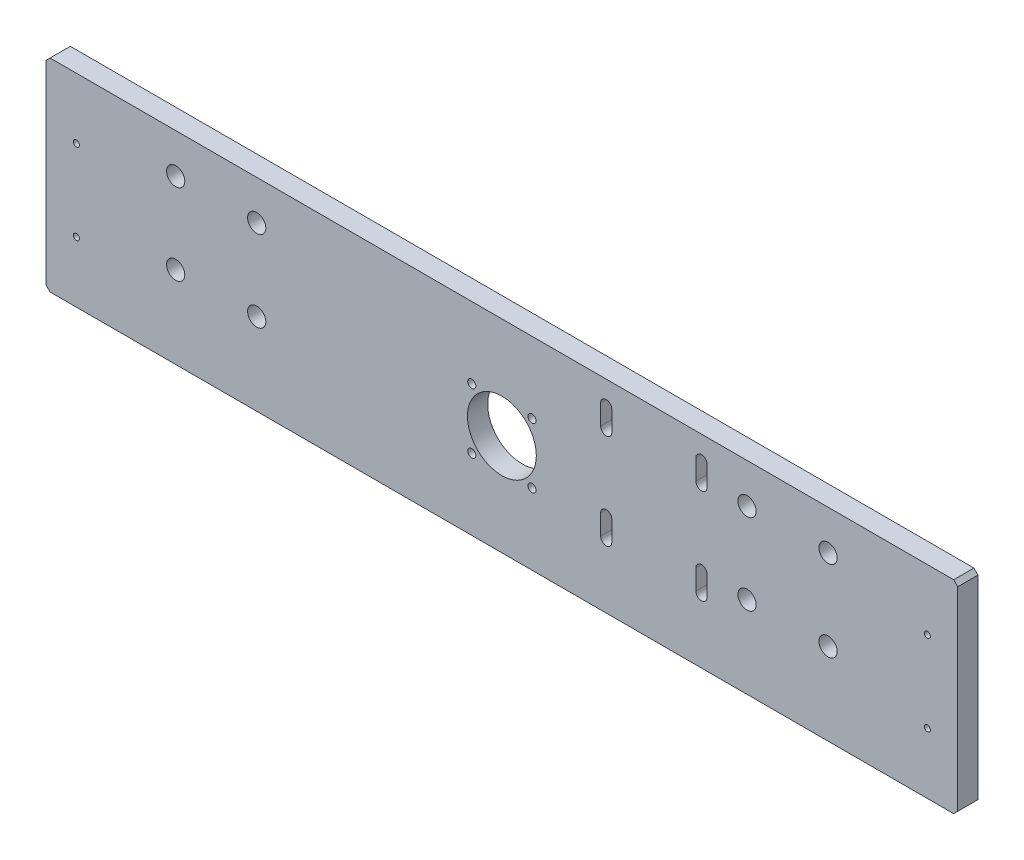
from build123d import *

# Parameters (mm, degrees)
SCHIZZO1_R          = 17
SCHIZZO1_R_2        = 2
SCHIZZO1_R_3        = 1.5
SCHIZZO1_R_4        = 4.5
BOSS_EXTRUDE1_DEPTH = 10


with BuildPart() as part:
    # Schizzo1 → Boss-Extrude1 (new body)
    with BuildSketch(Plane.XY):
        Polygon((2, 0), (448, 0), (450, 2), (450, 98), (448, 100), (2, 100), (0, 98), (0, 2), align=None)
        with Locations((225, 50)):
            Circle(SCHIZZO1_R, mode=Mode.SUBTRACT)
        with Locations((239.849242405, 64.849242405)):
            Circle(SCHIZZO1_R_2, mode=Mode.SUBTRACT)
        with Locations((239.849242405, 35.150757595)):
            Circle(SCHIZZO1_R_2, mode=Mode.SUBTRACT)
        with Locations((210.150757595, 35.150757595)):
            Circle(SCHIZZO1_R_2, mode=Mode.SUBTRACT)
        with Locations((15, 30)):
            Circle(SCHIZZO1_R_3, mode=Mode.SUBTRACT)
        with Locations((435, 30)):
            Circle(SCHIZZO1_R_3, mode=Mode.SUBTRACT)
        with Locations((210.150757595, 64.849242405)):
            Circle(SCHIZZO1_R_2, mode=Mode.SUBTRACT)
        with Locations((435, 70)):
            Circle(SCHIZZO1_R_3, mode=Mode.SUBTRACT)
        with Locations((15, 70)):
            Circle(SCHIZZO1_R_3, mode=Mode.SUBTRACT)
        with Locations((104, 80.5)):
            Circle(SCHIZZO1_R_4, mode=Mode.SUBTRACT)
        with Locations((104, 40.5)):
            Circle(SCHIZZO1_R_4, mode=Mode.SUBTRACT)
        with Locations((64, 80.5)):
            Circle(SCHIZZO1_R_4, mode=Mode.SUBTRACT)
        with Locations((64, 40.5)):
            Circle(SCHIZZO1_R_4, mode=Mode.SUBTRACT)
        with Locations((386, 40.5)):
            Circle(SCHIZZO1_R_4, mode=Mode.SUBTRACT)
        with Locations((346, 40.5)):
            Circle(SCHIZZO1_R_4, mode=Mode.SUBTRACT)
        with Locations((346, 80.5)):
            Circle(SCHIZZO1_R_4, mode=Mode.SUBTRACT)
        with Locations((386, 80.5)):
            Circle(SCHIZZO1_R_4, mode=Mode.SUBTRACT)
        with BuildLine():
            Line((320.75, 88.5), (320.75, 78.5))
            ThreePointArc((320.75, 78.5), (323.5, 75.75), (326.25, 78.5))
            Line((326.25, 78.5), (326.25, 88.5))
            ThreePointArc((326.25, 88.5), (323.5, 91.25), (320.75, 88.5))
        make_face(mode=Mode.SUBTRACT)
        with BuildLine():
            Line((279.25, 88.5), (279.25, 78.5))
            ThreePointArc((279.25, 78.5), (276.5, 75.75), (273.75, 78.5))
            Line((273.75, 78.5), (273.75, 88.5))
            ThreePointArc((273.75, 88.5), (276.5, 91.25), (279.25, 88.5))
        make_face(mode=Mode.SUBTRACT)
        with BuildLine():
            Line((320.75, 31.5), (320.75, 41.5))
            ThreePointArc((320.75, 41.5), (323.5, 44.25), (326.25, 41.5))
            Line((326.25, 41.5), (326.25, 31.5))
            ThreePointArc((326.25, 31.5), (323.5, 28.75), (320.75, 31.5))
        make_face(mode=Mode.SUBTRACT)
        with BuildLine():
            Line((279.25, 31.5), (279.25, 41.5))
            ThreePointArc((279.25, 41.5), (276.5, 44.25), (273.75, 41.5))
            Line((273.75, 41.5), (273.75, 31.5))
            ThreePointArc((273.75, 31.5), (276.5, 28.75), (279.25, 31.5))
        make_face(mode=Mode.SUBTRACT)
    extrude(amount=-BOSS_EXTRUDE1_DEPTH)


solid = part.part
